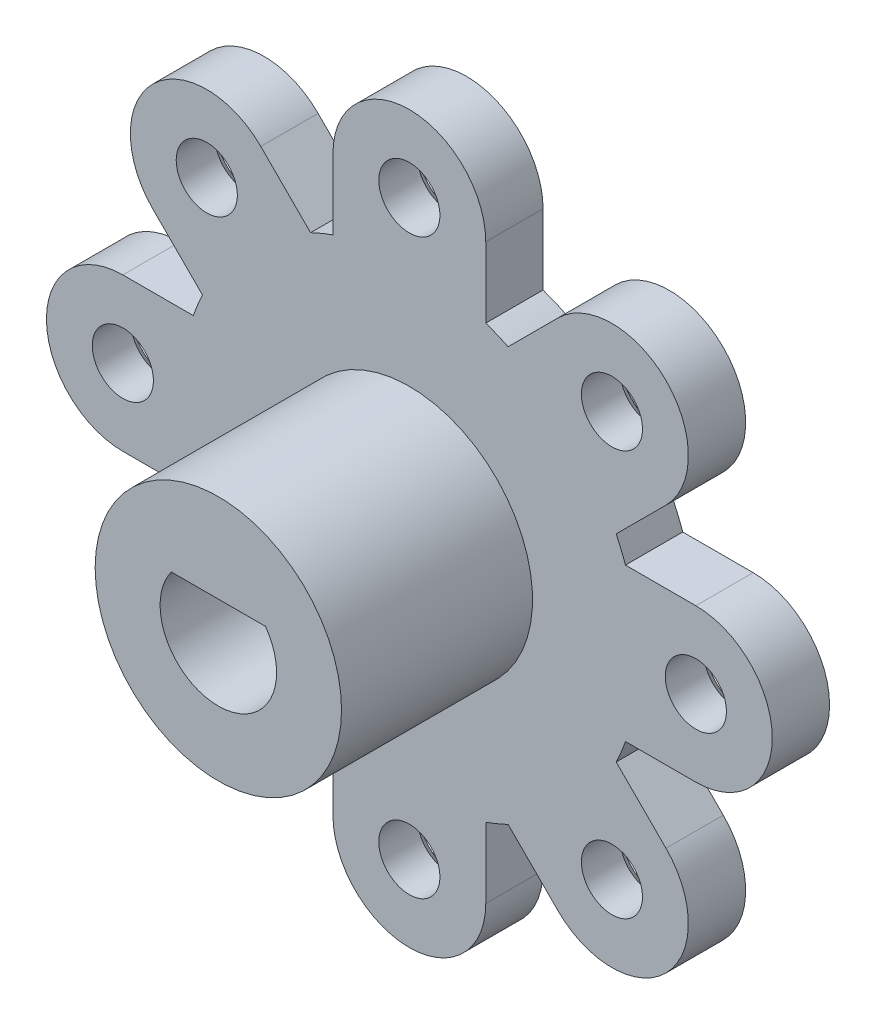
from build123d import *
from build123d.topology import SkipClean

# Parameters (mm, degrees)
MAIN_DEPTH                                     = 3
R_P_TITION_CIRCULAIRE1_COUNT                   = 8
ESQUISSE2_R                                    = 6.45
ESQUISSE2_R_2                                  = 3.05
MOTORLINK_DEPTH                                = 10
MEPLAT_DEPTH                                   = 10
ESQUISSE4_R                                    = 3.05
HOLE_DEPTH                                     = 29.670542374
ESQUISSE5_R                                    = 4
ESQUISSE5_R_2                                  = 3.05
ROLLINGBEARINGLINK_DEPTH                       = 7
ESQUISSE6_R                                    = 5
ESQUISSE6_R_2                                  = 4
ROLLINGBEARLINK2_DEPTH                         = 0.5
FRAISAGE_POUR_VIS_T_TE_FRAIS_E_100_D           = 3.2
FRAISAGE_POUR_VIS_T_TE_FRAIS_E_100_CSINK_D     = 5.5
FRAISAGE_POUR_VIS_T_TE_FRAIS_E_100_CSINK_ANGLE = 100
R_P_TITION_CIRCULAIRE2_COUNT                   = 8


with BuildPart() as part:
    # Esquisse1 → Main (new body)
    with BuildSketch(Plane.XY):
        with BuildLine():
            Line((11.313708499, 4), (15, 4))
            ThreePointArc((15, 4), (19, 0), (15, -4))
            Line((15, -4), (11.313708499, -4))
            ThreePointArc((11.313708499, -4), (11.204044803, -4.297601664), (11.08655439, -4.592201188))
            Line((11.08655439, -4.592201188), (0, 0))
            Line((0, 0), (11.08655439, 4.592201188))
            ThreePointArc((11.08655439, 4.592201188), (11.204044803, 4.297601664), (11.313708499, 4))
        make_face()
    main = extrude(amount=MAIN_DEPTH)

    # Répétition circulaire1: Main ×8 about axis
    r_p_tition_circulaire1_axis = Axis((0, 0, 11.883707709), (0, 0, -1))
    for i in range(1, R_P_TITION_CIRCULAIRE1_COUNT):
        add(main.rotate(r_p_tition_circulaire1_axis, i * 360 / R_P_TITION_CIRCULAIRE1_COUNT))

    # Esquisse2 → MotorLink (add)
    with BuildSketch(Plane.XY.offset(3)):
        Circle(ESQUISSE2_R)
        Circle(ESQUISSE2_R_2, mode=Mode.SUBTRACT)
    extrude(amount=MOTORLINK_DEPTH)

    # Esquisse3 → Meplat (add)
    with BuildSketch(Plane.XY.offset(3)):
        with BuildLine():
            Line((-2.46221445, 1.8), (2.46221445, 1.8))
            ThreePointArc((2.46221445, 1.8), (0, 3.05), (-2.46221445, 1.8))
        make_face()
    extrude(amount=MEPLAT_DEPTH)

    # Esquisse4 → Hole (cut, through all)
    with SkipClean():  # the faces are left unmerged after this step: merging them gives an invalid solid
        with BuildSketch(Plane.XY.offset(3)):
            Circle(ESQUISSE4_R)
        extrude(amount=-HOLE_DEPTH, mode=Mode.SUBTRACT)

    # Esquisse5 → RollingBearingLink (add)
    with SkipClean():  # the faces are left unmerged after this step: merging them gives an invalid solid
        with BuildSketch(Plane(origin=(0, 0, 0), x_dir=(-1, 0, 0), z_dir=(0, 0, -1))):
            Circle(ESQUISSE5_R)
            Circle(ESQUISSE5_R_2, mode=Mode.SUBTRACT)
        extrude(amount=ROLLINGBEARINGLINK_DEPTH)

    # Esquisse6 → RollingBearLink2 (add)
    with SkipClean():  # the faces are left unmerged after this step: merging them gives an invalid solid
        with BuildSketch(Plane(origin=(0, 0, 0), x_dir=(-1, 0, 0), z_dir=(0, 0, -1))):
            Circle(ESQUISSE6_R)
            Circle(ESQUISSE6_R_2, mode=Mode.SUBTRACT)
        extrude(amount=ROLLINGBEARLINK2_DEPTH)
    add(part.part.scale(1), mode=Mode.REPLACE)  # the faces are merged on a copy

    # Fraisage pour vis à tête fraisée (100) #01 (through all)
    with Locations(Plane(origin=(0, 0, 0), x_dir=(-1, 0, 0), z_dir=(0, 0, -1))):
        with Locations((15, 0)):
            fraisage_pour_vis_t_te_frais_e_100 = CounterSinkHole(FRAISAGE_POUR_VIS_T_TE_FRAIS_E_100_D / 2, FRAISAGE_POUR_VIS_T_TE_FRAIS_E_100_CSINK_D / 2, counter_sink_angle=FRAISAGE_POUR_VIS_T_TE_FRAIS_E_100_CSINK_ANGLE)

    # Répétition circulaire2: Fraisage pour vis à tête fraisée (100) #01 ×8 about axis
    r_p_tition_circulaire2_axis = Axis((0, 0, 11.883707709), (0, 0, -1))
    for i in range(1, R_P_TITION_CIRCULAIRE2_COUNT):
        add(fraisage_pour_vis_t_te_frais_e_100.rotate(r_p_tition_circulaire2_axis, i * 360 / R_P_TITION_CIRCULAIRE2_COUNT), mode=Mode.SUBTRACT)


solid = part.part
